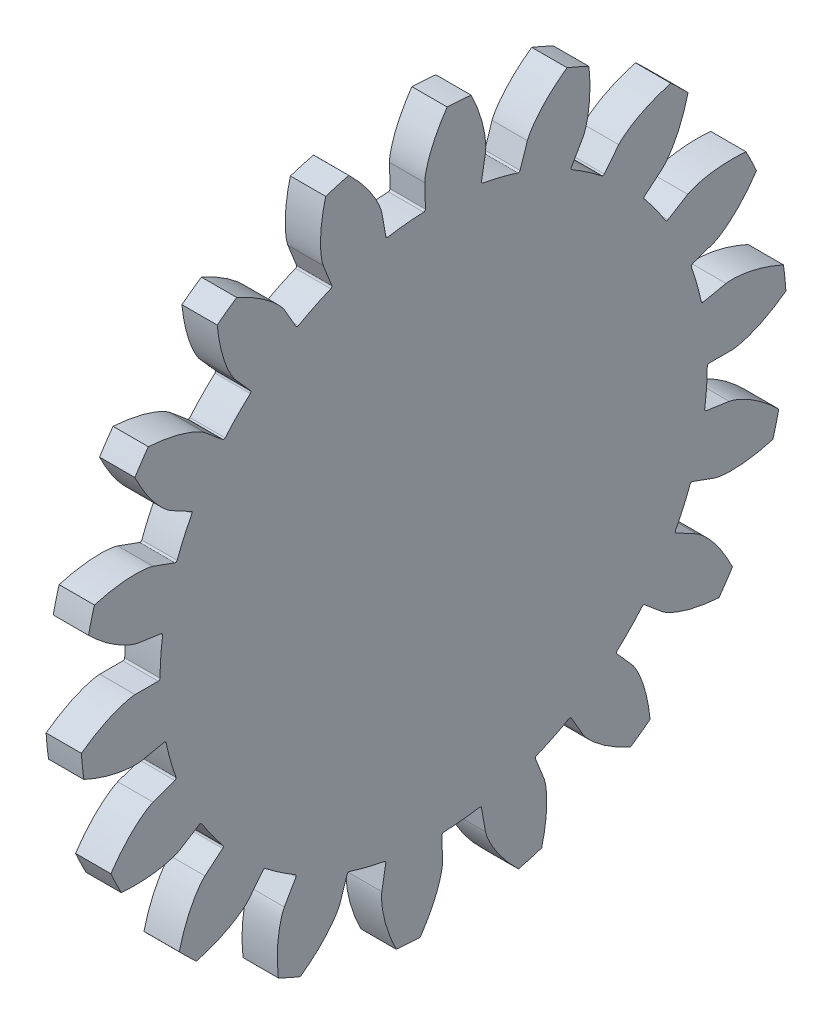
from build123d import *

# Parameters (mm, degrees)
SKETCH1_R                 = 20
BOSS_EXTRUDE1_DEPTH       = 1
CUT_EXTRUDE1_START        = -1
CUT_EXTRUDE1_DEPTH        = 2
FILLET1_R                 = 0.1
CIRPATTERN12_COUNT        = 18
FILLET1_OF_CIRPATTERN12_R = 0.1


# Read off the part's stored shape, not the designer's step: Cut-Extrude1
with BuildPart() as part:
    # Sketch1 → Boss-Extrude1 (new, symmetric)
    with BuildSketch(Plane(origin=(0, 0, 0), x_dir=(0, 0, -1), z_dir=(1, 0, 0))):
        Circle(SKETCH1_R)
    extrude(amount=BOSS_EXTRUDE1_DEPTH, both=True)

    # Cut-Extrude1 outline → Cut-Extrude1 (cut)
    with BuildSketch(Plane(origin=(0, 0, 0), x_dir=(0, 0, -1), z_dir=(1, 0, 0)).offset(CUT_EXTRUDE1_START)):
        with BuildLine():
            ThreePointArc((19.548811852, -4.224210598), (19.94766014, -1.445978881), (19.953656645, 1.360730131))
            add(Edge.make_bspline(
                [(19.953656645, 1.360730131), (19.922055533, 1.337733725), (19.843217444, 1.280899218), (19.705865813, 1.183398212), (19.533654483, 1.068501628), (19.33004024, 0.937485176), (19.131696754, 0.818246803), (18.925116542, 0.700197683), (18.718530475, 0.590375571), (18.506838266, 0.485098879), (18.297145116, 0.389263882), (18.110736467, 0.311090016), (17.950078977, 0.249429929), (17.815384107, 0.201523596), (17.703698808, 0.164482375), (17.59112204, 0.129889679), (17.477792015, 0.09808773), (17.363732252, 0.069310924), (17.258465586, 0.046084407), (17.162339913, 0.027916051), (17.080487979, 0.015141179), (17.017010648, 0.007137451), (16.96709434, 0.002519516), (16.936463223, 0.000574129), (16.92024945, 8.3189e-05), (16.914467174, 0)],
                knots=[0.126495611, 0.126495611, 0.126495611, 0.126495611, 0.126495611, 0.164197227, 0.218929528, 0.273661933, 0.328394299, 0.383126633, 0.437858978, 0.492591254, 0.547323563, 0.602055883, 0.65278357, 0.680149902, 0.707515959, 0.734882061, 0.762248419, 0.789614739, 0.816980389, 0.844236066, 0.862480775, 0.880559095, 0.894007227, 0.903714166, 0.909090915, 0.909090915, 0.909090915, 0.909090915, 0.909090915], degree=4))
            Line((16.914467174, 0), (15.5, 0))
            ThreePointArc((15.5, 0), (15.459436609, -1.120633632), (15.337958743, -2.235401884))
            Line((15.337958743, -2.235401884), (16.737638689, -2.439395599))
            add(Edge.make_bspline(
                [(16.737638689, -2.439395599), (16.743348518, -2.440311835), (16.759321985, -2.443135985), (16.789352313, -2.449478638), (16.838080786, -2.4612472), (16.899740214, -2.478321922), (16.978894061, -2.502767885), (17.071394578, -2.534609499), (17.172211041, -2.572774702), (17.280928216, -2.617700307), (17.388486998, -2.665514186), (17.494897917, -2.715981004), (17.600073562, -2.76874218), (17.726451269, -2.835573312), (17.876536616, -2.919758726), (18.049722303, -3.023999099), (18.24340199, -3.149074047), (18.437698161, -3.283780287), (18.626286033, -3.422248023), (18.813681616, -3.568855915), (18.99275507, -3.71545273), (19.175345549, -3.87446464), (19.32918621, -4.012996292), (19.451040386, -4.129286775), (19.520857636, -4.196897107), (19.548811852, -4.224210598)],
                knots=[0, 0, 0, 0, 0, 0.005376749, 0.015083688, 0.02853182, 0.04661014, 0.064854849, 0.092110525, 0.119476176, 0.146842496, 0.174208854, 0.201574956, 0.228941013, 0.256307345, 0.307035032, 0.361767352, 0.416499661, 0.471231937, 0.525964282, 0.580696616, 0.635428982, 0.690161387, 0.744893688, 0.782595304, 0.782595304, 0.782595304, 0.782595304, 0.782595304], degree=4))
        make_face()
    cut_extrude1 = extrude(amount=CUT_EXTRUDE1_DEPTH, mode=Mode.SUBTRACT)

    # Fillet1
    fillet1_edges = [part.edges().sort_by_distance(p)[0] for p in [
        (0, 0, -15.5),
        (0, -2.235401884, -15.337958743),
    ]]
    fillet(fillet1_edges, radius=FILLET1_R)

    # CirPattern12: Cut-Extrude1 ×18 about axis
    cirpattern12_axis = Axis((1, 0, 0), (-1, 0, 0))
    for i in range(1, CIRPATTERN12_COUNT):
        add(cut_extrude1.rotate(cirpattern12_axis, i * 360 / CIRPATTERN12_COUNT), mode=Mode.SUBTRACT)

    # Fillet1 of CirPattern12
    fillet1_of_cirpattern12_edges = [part.edges().sort_by_distance(p)[0] for p in [
        (0, -5.301312222, -14.565235622),
        (0, -7.346481502, -13.648414176),
        (0, -9.96320795, -11.873688868),
        (0, -11.571467029, -10.31266943),
        (0, -13.423393759, -7.75),
        (0, -14.400762856, -5.733064552),
        (0, -15.264520172, -2.691546754),
        (0, -15.493114149, -0.461967478),
        (0, -15.264520172, 2.691546754),
        (0, -14.716767222, 4.864849691),
        (0, -13.423393759, 7.75),
        (0, -12.165360972, 9.604894191),
        (0, -9.96320795, 11.873688868),
        (0, -8.146632647, 13.186446698),
        (0, -5.301312222, 14.565235622),
        (0, -3.145300193, 15.177519121),
        (0, 0, 15.5),
        (0, 2.235401884, 15.337958743),
        (0, 5.301312222, 14.565235622),
        (0, 7.346481502, 13.648414176),
        (0, 9.96320795, 11.873688868),
        (0, 11.571467029, 10.31266943),
        (0, 13.423393759, 7.75),
        (0, 14.400762856, 5.733064552),
        (0, 15.264520172, 2.691546754),
        (0, 15.493114149, 0.461967478),
        (0, 15.264520172, -2.691546754),
        (0, 14.716767222, -4.864849691),
        (0, 13.423393759, -7.75),
        (0, 12.165360972, -9.604894191),
        (0, 9.96320795, -11.873688868),
        (0, 8.146632647, -13.186446698),
        (0, 5.301312222, -14.565235622),
        (0, 3.145300193, -15.177519121),
    ]]
    fillet(fillet1_of_cirpattern12_edges, radius=FILLET1_OF_CIRPATTERN12_R)


solid = part.part
